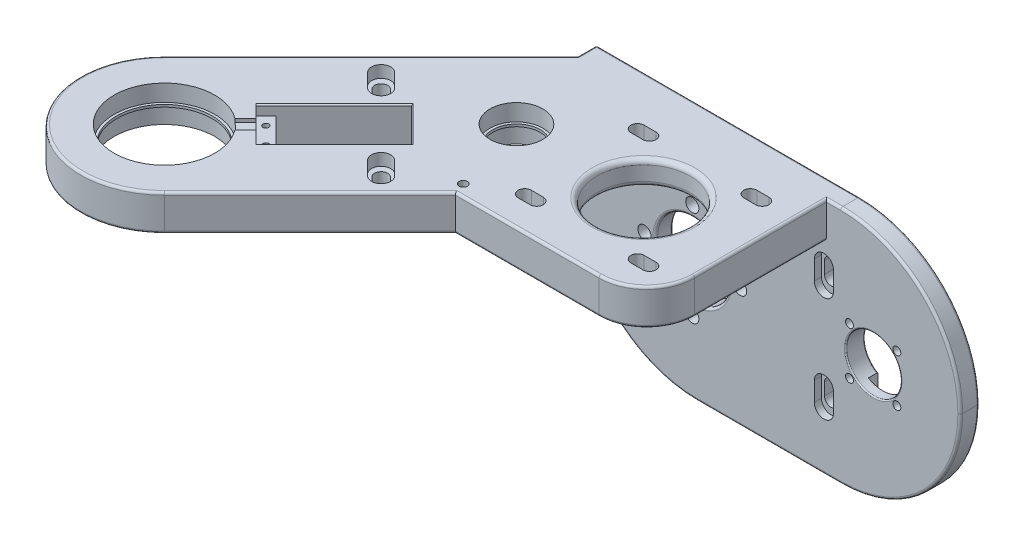
from build123d import *

# Parameters (mm, degrees)
SKETCH1_W           = 160
SKETCH1_H           = 100
SKETCH1_R           = 15.5
SKETCH1_R_2         = 2.75
SKETCH1_R_3         = 1.65
SKETCH1_R_4         = 11.5
BOSS_EXTRUDE1_DEPTH = 8
SKETCH3_R           = 33
CUT_EXTRUDE1_DEPTH  = 0.5
FILLET1_R           = 50
SKETCH5_R           = 10
SKETCH5_R_2         = 19.5
SKETCH5_R_3         = 20
SKETCH5_R_4         = 1.25
SKETCH5_R_5         = 1.75
BOSS_EXTRUDE2_DEPTH = 15
FILLET2_R           = 20
SKETCH6_W           = 61
SKETCH6_H           = 61
CUT_EXTRUDE2_DEPTH  = 5
SKETCH7_R           = 11.05
CUT_EXTRUDE3_DEPTH  = 7
CUT_EXTRUDE4_START  = -7
SKETCH8_R           = 11.05
CUT_EXTRUDE4_DEPTH  = 7
SKETCH10_R          = 21.05
CUT_EXTRUDE5_DEPTH  = 7
CUT_EXTRUDE6_START  = -7
SKETCH11_R          = 21.05
CUT_EXTRUDE6_DEPTH  = 7
CUT_EXTRUDE8_DEPTH  = 5
CUT_EXTRUDE10_DEPTH = 4
CUT_EXTRUDE11_DEPTH = 4.1
CUT_EXTRUDE12_DEPTH = 1.5
FILLET3_R           = 1
FILLET4_R           = 1
FILLET5_R           = 0.5
FILLET6_R           = 2
CHAMFER1_SIZE       = 0.5
FILLET7_R           = 3
CUT_EXTRUDE13_DEPTH = 240.621308305
CUT_EXTRUDE14_DEPTH = 3
CUT_EXTRUDE16_DEPTH = 4


with BuildPart() as part:
    # Sketch1 → Boss-Extrude1 (new body)
    with BuildSketch(Plane.XY):
        Rectangle(SKETCH1_W, SKETCH1_H)
        with Locations((-32, 0)):
            Circle(SKETCH1_R, mode=Mode.SUBTRACT)
        with Locations((-12, 0)):
            Circle(SKETCH1_R_2, mode=Mode.SUBTRACT)
        with Locations((53.499494937, 9.899494937)):
            Circle(SKETCH1_R_3, mode=Mode.SUBTRACT)
        with Locations((33.700505063, 9.899494937)):
            Circle(SKETCH1_R_3, mode=Mode.SUBTRACT)
        with Locations((53.499494937, -9.899494937)):
            Circle(SKETCH1_R_3, mode=Mode.SUBTRACT)
        with Locations((33.700505063, -9.899494937)):
            Circle(SKETCH1_R_3, mode=Mode.SUBTRACT)
        with Locations((-32, -20)):
            Circle(SKETCH1_R_2, mode=Mode.SUBTRACT)
        with Locations((-52, 0)):
            Circle(SKETCH1_R_2, mode=Mode.SUBTRACT)
        with Locations((-32, 20)):
            Circle(SKETCH1_R_2, mode=Mode.SUBTRACT)
        with Locations((43.6, 0)):
            Circle(SKETCH1_R_4, mode=Mode.SUBTRACT)
    extrude(amount=BOSS_EXTRUDE1_DEPTH)

    # Sketch3 → Cut-Extrude1 (cut)
    with BuildSketch(Plane(origin=(0, 0, 0), x_dir=(-1, 0, 0), z_dir=(0, 0, -1))):
        with Locations((32, 0)):
            Circle(SKETCH3_R)
    extrude(amount=-CUT_EXTRUDE1_DEPTH, mode=Mode.SUBTRACT)

    # Fillet1
    fillet1_edges = [part.edges().sort_by_distance(p)[0] for p in [
        (80, -50, 4),
        (80, 50, 4),
        (-80, -50, 4),
    ]]
    fillet(fillet1_edges, radius=FILLET1_R - 0.0001)  # a hair under: the kernel refuses the full size

    # Sketch5 → Boss-Extrude2 (add)
    with BuildSketch(Plane(origin=(0, 50, 0), x_dir=(1, 0, 0), z_dir=(0, 1, 0))):
        with BuildLine():
            Line((23.994949366, -8), (23.994949366, -83))
            Line((23.994949366, -83), (-56.005050634, -83))
            Line((-56.005050634, -83), (-116.828248558, -143.823197924))
            ThreePointArc((-116.828248558, -143.823197924), (-166.325723241, -143.823197924), (-166.325723241, -94.325723241))
            Line((-166.325723241, -94.325723241), (-80, -8))
            Line((-80, -8), (23.994949366, -8))
        make_face()
        with Locations(Location((-68.002525317, -45.5, 0), (0, 0, 270))):
            Circle(SKETCH5_R, mode=Mode.SUBTRACT)
        with Locations(Location((-14.902525317, -45.5, 0), (0, 0, 270))):
            Circle(SKETCH5_R_2, mode=Mode.SUBTRACT)
        with Locations(Location((-141.576985899, -119.074460582, 0), (0, 0, 270))):
            Circle(SKETCH5_R_3, mode=Mode.SUBTRACT)
        with Locations(Location((-116.828248558, -101.396791053, 0), (0, 0, 270))):
            Circle(SKETCH5_R_4, mode=Mode.SUBTRACT)
        with Locations(Location((-123.89931637, -94.325723241, 0), (0, 0, 90))):
            Circle(SKETCH5_R_4, mode=Mode.SUBTRACT)
        with Locations(Location((-57.528638359, -78.237786183, 0), (0, 0, 270))):
            Circle(SKETCH5_R_5, mode=Mode.SUBTRACT)
        with BuildLine():
            Line((-35.972525317, -71.82), (-40.972525317, -71.82))
            ThreePointArc((-40.972525317, -71.82), (-43.722525317, -69.07), (-40.972525317, -66.32))
            Line((-40.972525317, -66.32), (-35.972525317, -66.32))
            ThreePointArc((-35.972525317, -66.32), (-33.222525317, -69.07), (-35.972525317, -71.82))
        make_face(mode=Mode.SUBTRACT)
        with BuildLine():
            Line((11.167474683, -71.82), (6.167474683, -71.82))
            ThreePointArc((6.167474683, -71.82), (3.417474683, -69.07), (6.167474683, -66.32))
            Line((6.167474683, -66.32), (11.167474683, -66.32))
            ThreePointArc((11.167474683, -66.32), (13.917474683, -69.07), (11.167474683, -71.82))
        make_face(mode=Mode.SUBTRACT)
        with BuildLine():
            Line((11.167474683, -24.68), (6.167474683, -24.68))
            ThreePointArc((6.167474683, -24.68), (3.417474683, -21.93), (6.167474683, -19.18))
            Line((6.167474683, -19.18), (11.167474683, -19.18))
            ThreePointArc((11.167474683, -19.18), (13.917474683, -21.93), (11.167474683, -24.68))
        make_face(mode=Mode.SUBTRACT)
        with BuildLine():
            Line((-35.972525317, -24.68), (-40.972525317, -24.68))
            ThreePointArc((-40.972525317, -24.68), (-43.722525317, -21.93), (-40.972525317, -19.18))
            Line((-40.972525317, -19.18), (-35.972525317, -19.18))
            ThreePointArc((-35.972525317, -19.18), (-33.222525317, -21.93), (-35.972525317, -24.68))
        make_face(mode=Mode.SUBTRACT)
        with BuildLine():
            Line((-80.553670683, -93.406484425), (-84.089204589, -89.870950519))
            ThreePointArc((-84.089204589, -89.870950519), (-84.089204589, -85.981863223), (-80.200117292, -85.981863223))
            Line((-80.200117292, -85.981863223), (-76.664583386, -89.517397129))
            ThreePointArc((-76.664583386, -89.517397129), (-76.664583386, -93.406484425), (-80.553670683, -93.406484425))
        make_face(mode=Mode.SUBTRACT)
        with BuildLine():
            Line((-112.373475836, -61.586679272), (-115.909009742, -58.051145366))
            ThreePointArc((-115.909009742, -58.051145366), (-115.909009742, -54.16205807), (-112.019922446, -54.16205807))
            Line((-112.019922446, -54.16205807), (-108.48438854, -57.697591975))
            ThreePointArc((-108.48438854, -57.697591975), (-108.48438854, -61.586679272), (-112.373475836, -61.586679272))
        make_face(mode=Mode.SUBTRACT)
        Polygon((-125.313529932, -88.668868991), (-111.171394308, -102.811004615), (-82.887123061, -74.526733368), (-97.029258685, -60.384597744), align=None, mode=Mode.SUBTRACT)
    extrude(amount=-BOSS_EXTRUDE2_DEPTH)

    # Fillet2
    fillet2_edges = [part.edges().sort_by_distance(p)[0] for p in [
        (23.994949366, 42.5, 83),
    ]]
    fillet(fillet2_edges, radius=FILLET2_R)

    # Sketch6 → Cut-Extrude2 (cut)
    with BuildSketch(Plane.XZ.offset(-35)):
        with Locations((-14.902525317, 45.5)):
            Rectangle(SKETCH6_W, SKETCH6_H)
    extrude(amount=-CUT_EXTRUDE2_DEPTH, mode=Mode.SUBTRACT)

    # Sketch7 → Cut-Extrude3 (cut)
    with BuildSketch(Plane(origin=(0, 50, 0), x_dir=(1, 0, 0), z_dir=(0, 1, 0))):
        with Locations(Location((-68.002525317, -45.5, 0), (0, 0, 270))):
            Circle(SKETCH7_R)
    extrude(amount=-CUT_EXTRUDE3_DEPTH, mode=Mode.SUBTRACT)

    # Sketch8 → Cut-Extrude4 (cut)
    with BuildSketch(Plane.XZ.offset(-35).offset(CUT_EXTRUDE4_START)):
        with Locations(Location((-68.002525317, 45.5, 0), (0, 0, 90))):
            Circle(SKETCH8_R)
    extrude(amount=CUT_EXTRUDE4_DEPTH, mode=Mode.SUBTRACT)

    # Sketch10 → Cut-Extrude5 (cut)
    with BuildSketch(Plane(origin=(0, 50, 0), x_dir=(1, 0, 0), z_dir=(0, 1, 0))):
        with Locations(Location((-141.576985899, -119.074460582, 0), (0, 0, 270))):
            Circle(SKETCH10_R)
    extrude(amount=-CUT_EXTRUDE5_DEPTH, mode=Mode.SUBTRACT)

    # Sketch11 → Cut-Extrude6 (cut)
    with BuildSketch(Plane.XZ.offset(-35).offset(CUT_EXTRUDE6_START)):
        with Locations(Location((-141.576985899, 119.074460582, 0), (0, 0, 90))):
            Circle(SKETCH11_R)
    extrude(amount=CUT_EXTRUDE6_DEPTH, mode=Mode.SUBTRACT)

    # Sketch14 → Cut-Extrude8 (cut)
    with BuildSketch(Plane(origin=(0, 50, 0), x_dir=(1, 0, 0), z_dir=(0, 1, 0))):
        with BuildLine():
            Line((-80.376893988, -95.351028074), (-86.033748237, -89.694173824))
            ThreePointArc((-86.033748237, -89.694173824), (-86.033748237, -84.037319575), (-80.376893988, -84.037319575))
            Line((-80.376893988, -84.037319575), (-74.720039738, -89.694173824))
            ThreePointArc((-74.720039738, -89.694173824), (-74.720039738, -95.351028074), (-80.376893988, -95.351028074))
        make_face()
        with BuildLine():
            Line((-112.196699141, -63.53122292), (-117.853553391, -57.874368671))
            ThreePointArc((-117.853553391, -57.874368671), (-117.853553391, -52.217514421), (-112.196699141, -52.217514421))
            Line((-112.196699141, -52.217514421), (-106.539844892, -57.874368671))
            ThreePointArc((-106.539844892, -57.874368671), (-106.539844892, -63.53122292), (-112.196699141, -63.53122292))
        make_face()
    extrude(amount=-CUT_EXTRUDE8_DEPTH, mode=Mode.SUBTRACT)

    # Sketch15 → Cut-Extrude10 (cut)
    with BuildSketch(Plane.XZ.offset(-35)):
        Polygon((-111.171394308, 102.811004615), (-115.414034995, 107.053645302), (-129.556170619, 92.911509679), (-125.313529932, 88.668868991), align=None)
    extrude(amount=-CUT_EXTRUDE10_DEPTH, mode=Mode.SUBTRACT)

    # Sketch16 → Cut-Extrude11 (cut)
    with BuildSketch(Plane(origin=(0, 50, 0), x_dir=(1, 0, 0), z_dir=(0, 1, 0))):
        Polygon((-125.313529932, -88.668868991), (-129.556170619, -92.911509679), (-115.414034995, -107.053645302), (-111.171394308, -102.811004615), align=None)
    extrude(amount=-CUT_EXTRUDE11_DEPTH, mode=Mode.SUBTRACT)

    # Sketch17 → Cut-Extrude12 (cut)
    with BuildSketch(Plane(origin=(0, 50, 0), x_dir=(1, 0, 0), z_dir=(0, 1, 0))):
        Polygon((-124.606423151, -97.861257147), (-130.2632774, -103.518111396), (-126.020636713, -107.760752083), (-120.363782464, -102.103897834), align=None)
    extrude(amount=-CUT_EXTRUDE12_DEPTH, mode=Mode.SUBTRACT)

    # Fillet3
    fillet3_edges = [part.edges().sort_by_distance(p)[0] for p in [
        (23.994949366, 35, 35.5),
        (18.13708499, 35, 77.142135624),
        (-123.16286162, 50, 51.16286162),
        (-166.325723241, 50, 143.823197924),
        (-26.005050634, 50, 83),
        (23.994949366, 50, 35.5),
        (-24.99995, 50, 0),
        (-80, 24.99995, 0),
        (-65.355368349, -35.355368349, 0),
        (0, -50, 0),
        (65.355368349, -35.355368349, 0),
        (-80, 17.49995, 8),
        (-65.355368349, -35.355368349, 8),
        (0, -50, 8),
        (65.355368349, -35.355368349, 8),
        (26.997524683, 50, 8),
        (-26.005050634, 35, 83),
        (-80, 50, 4),
        (-86.416649596, 50, 113.411598962),
        (18.13708499, 50, 77.142135624),
        (65.355368349, 35.355368349, 0),
        (65.355368349, 35.355368349, 8),
    ]]
    fillet(fillet3_edges, radius=FILLET3_R)

    # Fillet4
    fillet4_edges = [part.edges().sort_by_distance(p)[0] for p in [
        (-123.16286162, 35, 51.16286162),
        (-166.325723241, 35, 143.823197924),
        (-47.5, 0, 0.5),
        (-47.5, 0, 8),
        (-85.916649596, 35, 112.911598962),
    ]]
    fillet(fillet4_edges, radius=FILLET4_R)

    # Fillet5
    fillet5_edges = [part.edges().sort_by_distance(p)[0] for p in [
        (32.1, 0, 0),
        (32.1, 0, 8),
    ]]
    fillet(fillet5_edges, radius=FILLET5_R)

    # Fillet6
    fillet6_edges = [part.edges().sort_by_distance(p)[0] for p in [
        (-14.902525317, 50, 26),
        (-14.902525317, 40, 26),
    ]]
    fillet(fillet6_edges, radius=FILLET6_R)

    # Chamfer1
    chamfer1_edges = [part.edges().sort_by_distance(p)[0] for p in [
        (-99.150579028, 50, 90.790189335),
        (-113.292714652, 50, 76.648053711),
        (-89.958190873, 50, 67.455665556),
        (-122.485102807, 35, 99.98257749),
        (-99.150579028, 35, 90.790189335),
        (-89.958190873, 35, 67.455665556),
        (-113.292714652, 35, 76.648053711),
    ]]
    chamfer(chamfer1_edges, length=CHAMFER1_SIZE)

    # Fillet7
    fillet7_edges = [part.edges().sort_by_distance(p)[0] for p in [
        (15.597474683, 37.5, 76),
        (15.597474683, 37.5, 15),
        (-45.402525317, 37.5, 15),
        (-45.402525317, 37.5, 76),
    ]]
    fillet(fillet7_edges, radius=FILLET7_R)

    # Sketch18 → Cut-Extrude13 (cut, through all)
    with BuildSketch(Plane(origin=(0, 0, 0), x_dir=(-1, 0, 0), z_dir=(0, 0, -1))):
        with BuildLine():
            Line((-20.25, -19.5), (-20.25, -24.5))
            ThreePointArc((-20.25, -24.5), (-23, -27.25), (-25.75, -24.5))
            Line((-25.75, -24.5), (-25.75, -19.5))
            ThreePointArc((-25.75, -19.5), (-23, -16.75), (-20.25, -19.5))
        make_face()
        with BuildLine():
            Line((-20.25, 19.5), (-20.25, 24.5))
            ThreePointArc((-20.25, 24.5), (-23, 27.25), (-25.75, 24.5))
            Line((-25.75, 24.5), (-25.75, 19.5))
            ThreePointArc((-25.75, 19.5), (-23, 16.75), (-20.25, 19.5))
        make_face()
    extrude(amount=-CUT_EXTRUDE13_DEPTH, mode=Mode.SUBTRACT)

    # Sketch19 → Cut-Extrude14 (cut)
    with BuildSketch(Plane.XY.offset(8)):
        with BuildLine():
            Line((19, 18), (19, 26))
            ThreePointArc((19, 26), (23, 30), (27, 26))
            Line((27, 26), (27, 18))
            ThreePointArc((27, 18), (23, 14), (19, 18))
        make_face()
        with BuildLine():
            Line((19, -26), (19, -18))
            ThreePointArc((19, -18), (23, -14), (27, -18))
            Line((27, -18), (27, -26))
            ThreePointArc((27, -26), (23, -30), (19, -26))
        make_face()
    extrude(amount=-CUT_EXTRUDE14_DEPTH, mode=Mode.SUBTRACT)

    # Sketch20 → Cut-Extrude16 (cut)
    with BuildSketch(Plane(origin=(0, 0, 0), x_dir=(-1, 0, 0), z_dir=(0, 0, -1))):
        with BuildLine():
            Line((-37.6, 25), (-37.6, -25))
            ThreePointArc((-37.6, -25), (-43.6, -31), (-49.6, -25))
            Line((-49.6, -25), (-49.6, 25))
            ThreePointArc((-49.6, 25), (-43.6, 31), (-37.6, 25))
        make_face()
    extrude(amount=-CUT_EXTRUDE16_DEPTH, mode=Mode.SUBTRACT)


solid = part.part
